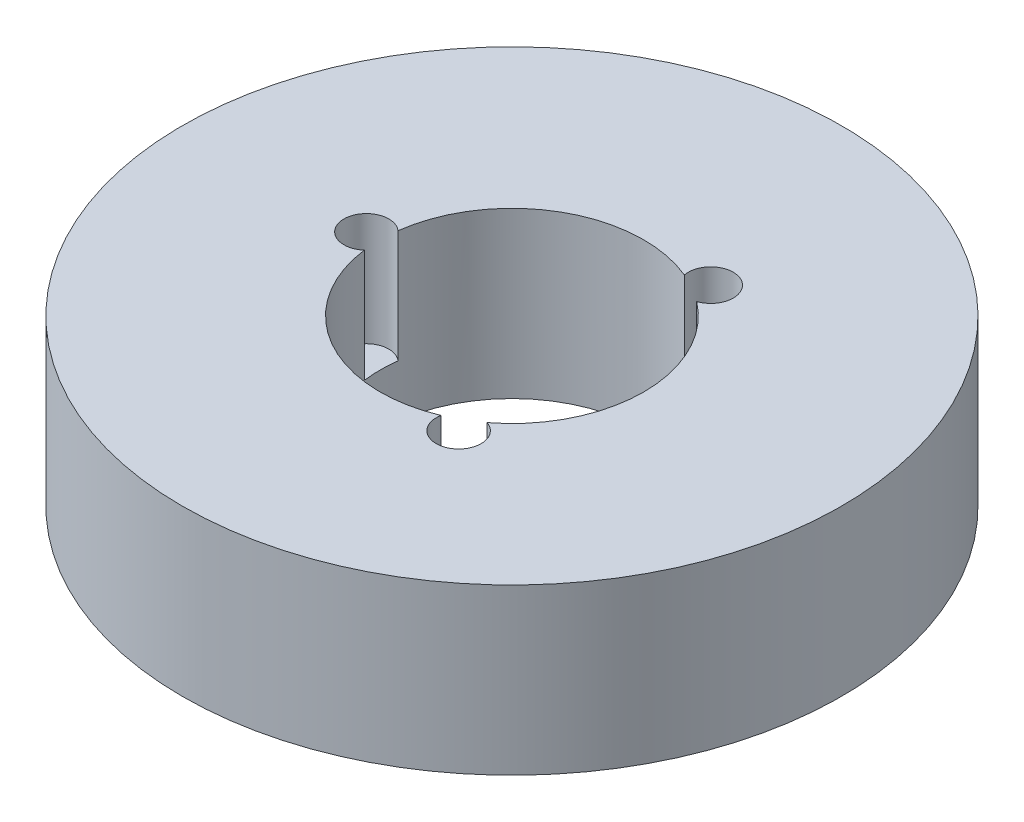
from build123d import *

# Parameters (mm, degrees)
SKETCH1_R           = 50
BOSS_EXTRUDE1_DEPTH = 25
SKETCH2_R           = 20
CUT_EXTRUDE1_DEPTH  = 76
SKETCH3_R           = 3.406342269
CUT_EXTRUDE2_DEPTH  = 17.105159093
CIRPATTERN1_COUNT   = 3


with BuildPart() as part:
    # Sketch1 → Boss-Extrude1 (new body)
    with BuildSketch(Plane(origin=(0, 0, 0), x_dir=(1, 0, 0), z_dir=(0, 1, 0))):
        Circle(SKETCH1_R)
    extrude(amount=BOSS_EXTRUDE1_DEPTH)

    # Sketch2 → Cut-Extrude1 (cut, through all)
    with BuildSketch(Plane(origin=(0, 0, 0), x_dir=(1, 0, 0), z_dir=(0, 1, 0))):
        Circle(SKETCH2_R)
    extrude(amount=CUT_EXTRUDE1_DEPTH, mode=Mode.SUBTRACT)

    # Sketch3 → Cut-Extrude2 (cut)
    with BuildSketch(Plane(origin=(0, 25, 0), x_dir=(1, 0, 0), z_dir=(0, 1, 0))):
        with Locations((-22.083899782, 0)):
            Circle(SKETCH3_R)
    cut_extrude2 = extrude(amount=-CUT_EXTRUDE2_DEPTH, mode=Mode.SUBTRACT)

    # CirPattern1: Cut-Extrude2 ×3 about axis
    cirpattern1_axis = Axis((0, 0, 0), (0, 1, 0))
    for i in range(1, CIRPATTERN1_COUNT):
        add(cut_extrude2.rotate(cirpattern1_axis, i * 360 / CIRPATTERN1_COUNT), mode=Mode.SUBTRACT)


solid = part.part
